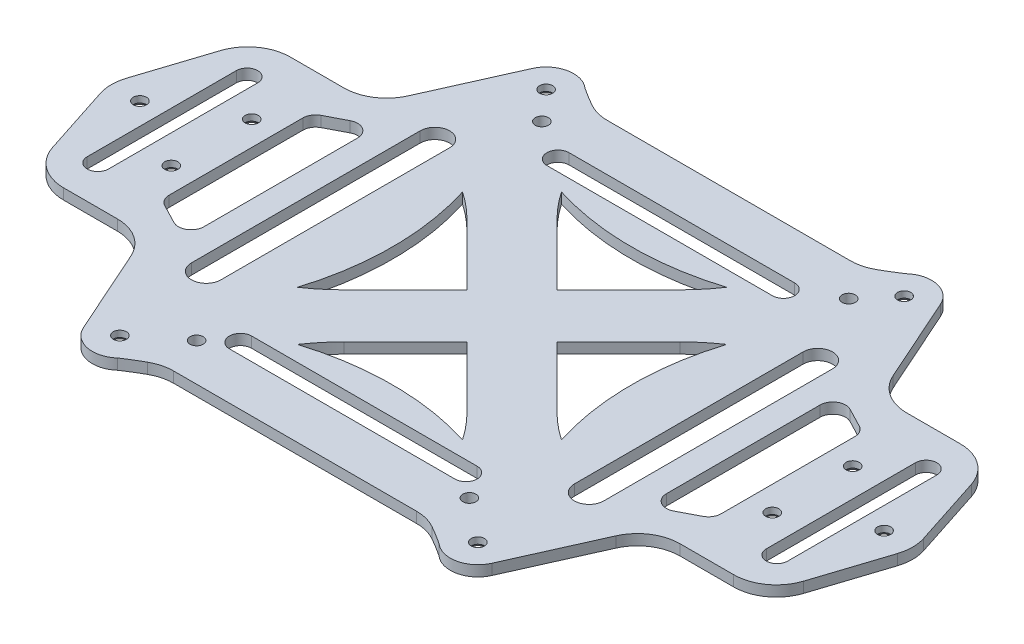
from build123d import *

# Parameters (mm, degrees)
SKETCH_1_R             = 1.55
EXTRUDE_1_DEPTH        = 2.5
FILLET_1_R             = 10
CHAMFER_2_SIZE         = 1
CUT_EXTRUDE_5190_DEPTH = 110.674480491
FILLET_2_R             = 3


with BuildPart() as part:
    # 草图1 → 凸台-拉伸1 (new body)
    with BuildSketch(Plane(origin=(0, 0, 0), x_dir=(1, 0, 0), z_dir=(0, 1, 0))):
        with BuildLine():
            Line((47.899982554, 52.633397656), (59.52497064, 26.588251477))
            Line((59.52497064, 26.588251477), (85.869588061, 26.588251477))
            Line((85.869588061, 26.588251477), (94.505759306, 0))
            Line((94.505759306, 0), (85.869588061, -26.588251477))
            Line((85.869588061, -26.588251477), (59.52497064, -26.588251477))
            Line((59.52497064, -26.588251477), (47.899982554, -52.633397656))
            ThreePointArc((47.899982554, -52.633397656), (43.362068791, -56.315801292), (37.709796983, -54.831018053))
            ThreePointArc((37.709796983, -54.831018053), (34.400449937, -52.764318952), (30.978168019, -50.89055015))
            Line((30.978168019, -50.89055015), (-30.978168019, -50.89055015))
            ThreePointArc((-30.978168019, -50.89055015), (-34.400449937, -52.764318952), (-37.709796983, -54.831018053))
            ThreePointArc((-37.709796983, -54.831018053), (-43.362068791, -56.315801292), (-47.899982554, -52.633397656))
            Line((-47.899982554, -52.633397656), (-59.52497064, -26.588251477))
            Line((-59.52497064, -26.588251477), (-85.869588061, -26.588251477))
            Line((-85.869588061, -26.588251477), (-94.505759306, 0))
            Line((-94.505759306, 0), (-85.869588061, 26.588251477))
            Line((-85.869588061, 26.588251477), (-59.52497064, 26.588251477))
            Line((-59.52497064, 26.588251477), (-47.899982554, 52.633397656))
            ThreePointArc((-47.899982554, 52.633397656), (-43.362068791, 56.315801292), (-37.709796983, 54.831018053))
            ThreePointArc((-37.709796983, 54.831018053), (-34.400449937, 52.764318952), (-30.978168019, 50.89055015))
            Line((-30.978168019, 50.89055015), (30.978168019, 50.89055015))
            ThreePointArc((30.978168019, 50.89055015), (34.400449937, 52.764318952), (37.709796983, 54.831018053))
            ThreePointArc((37.709796983, 54.831018053), (43.362068791, 56.315801292), (47.899982554, 52.633397656))
        make_face()
        with Locations((42, 50)):
            Circle(SKETCH_1_R, mode=Mode.SUBTRACT)
        with Locations((42, -50)):
            Circle(SKETCH_1_R, mode=Mode.SUBTRACT)
        with Locations((-42, -50)):
            Circle(SKETCH_1_R, mode=Mode.SUBTRACT)
        with Locations((-42, 50)):
            Circle(SKETCH_1_R, mode=Mode.SUBTRACT)
        with Locations((36, 43)):
            Circle(SKETCH_1_R, mode=Mode.SUBTRACT)
        with Locations((32, -42)):
            Circle(SKETCH_1_R, mode=Mode.SUBTRACT)
        with Locations((-32, -42)):
            Circle(SKETCH_1_R, mode=Mode.SUBTRACT)
        with Locations((-36, 43)):
            Circle(SKETCH_1_R, mode=Mode.SUBTRACT)
        with Locations((70.5, 9.435839055)):
            Circle(SKETCH_1_R, mode=Mode.SUBTRACT)
        with Locations((70.5, -9.435839055)):
            Circle(SKETCH_1_R, mode=Mode.SUBTRACT)
        with Locations((-70.5, -9.435839055)):
            Circle(SKETCH_1_R, mode=Mode.SUBTRACT)
        with Locations((-70.5, 9.435839055)):
            Circle(SKETCH_1_R, mode=Mode.SUBTRACT)
        with Locations((87.3, 0)):
            Circle(SKETCH_1_R, mode=Mode.SUBTRACT)
        with Locations((-87.3, 0)):
            Circle(SKETCH_1_R, mode=Mode.SUBTRACT)
        with BuildLine():
            Line((77.169642998, -17.5), (77.169642998, 17.5))
            ThreePointArc((77.169642998, 17.5), (79.669642998, 20), (82.169642998, 17.5))
            Line((82.169642998, 17.5), (82.169642998, -17.5))
            ThreePointArc((82.169642998, -17.5), (79.669642998, -20), (77.169642998, -17.5))
        make_face(mode=Mode.SUBTRACT)
        with BuildLine():
            Line((-77.169642998, -17.5), (-77.169642998, 17.5))
            ThreePointArc((-77.169642998, 17.5), (-79.669642998, 20), (-82.169642998, 17.5))
            Line((-82.169642998, 17.5), (-82.169642998, -17.5))
            ThreePointArc((-82.169642998, -17.5), (-79.669642998, -20), (-77.169642998, -17.5))
        make_face(mode=Mode.SUBTRACT)
        with BuildLine():
            Line((-24.995975583, 14.429581723), (-10.56639386, 0))
            Line((-10.56639386, 0), (-24.995975583, -14.429581723))
            ThreePointArc((-24.995975583, -14.429581723), (-27.869597938, -17.042325553), (-30.978168019, -19.370614155))
            ThreePointArc((-30.978168019, -19.370614155), (-28.024295248, 0), (-30.978168019, 19.370614155))
            ThreePointArc((-30.978168019, 19.370614155), (-27.869597938, 17.042325553), (-24.995975583, 14.429581723))
        make_face(mode=Mode.SUBTRACT)
        with BuildLine():
            Line((14.429581723, 24.995975583), (0, 10.56639386))
            Line((0, 10.56639386), (-14.429581723, 24.995975583))
            ThreePointArc((-14.429581723, 24.995975583), (-17.042325553, 27.869597938), (-19.370614155, 30.978168019))
            ThreePointArc((-19.370614155, 30.978168019), (0, 28.024295248), (19.370614155, 30.978168019))
            ThreePointArc((19.370614155, 30.978168019), (17.042325553, 27.869597938), (14.429581723, 24.995975583))
        make_face(mode=Mode.SUBTRACT)
        with BuildLine():
            Line((24.995975583, -14.429581723), (10.56639386, 0))
            Line((10.56639386, 0), (24.995975583, 14.429581723))
            ThreePointArc((24.995975583, 14.429581723), (27.869597938, 17.042325553), (30.978168019, 19.370614155))
            ThreePointArc((30.978168019, 19.370614155), (28.024295248, 0), (30.978168019, -19.370614155))
            ThreePointArc((30.978168019, -19.370614155), (27.869597938, -17.042325553), (24.995975583, -14.429581723))
        make_face(mode=Mode.SUBTRACT)
        with BuildLine():
            Line((-14.429581723, -24.995975583), (0, -10.56639386))
            Line((0, -10.56639386), (14.429581723, -24.995975583))
            ThreePointArc((14.429581723, -24.995975583), (17.042325553, -27.869597938), (19.370614155, -30.978168019))
            ThreePointArc((19.370614155, -30.978168019), (0, -28.024295248), (-19.370614155, -30.978168019))
            ThreePointArc((-19.370614155, -30.978168019), (-17.042325553, -27.869597938), (-14.429581723, -24.995975583))
        make_face(mode=Mode.SUBTRACT)
        with BuildLine():
            Line((41.468701347, -26.829343455), (41.468701347, 26.829343455))
            ThreePointArc((41.468701347, 26.829343455), (44.919200659, 30.279842767), (48.36969997, 26.829343455))
            Line((48.36969997, 26.829343455), (48.36969997, -26.829343455))
            ThreePointArc((48.36969997, -26.829343455), (44.919200659, -30.279842767), (41.468701347, -26.829343455))
        make_face(mode=Mode.SUBTRACT)
        with BuildLine():
            Line((-26.453510137, -34.636976429), (26.453510137, -34.636976429))
            ThreePointArc((26.453510137, -34.636976429), (29.060662927, -37.244129219), (26.453510137, -39.851282009))
            Line((26.453510137, -39.851282009), (-26.453510137, -39.851282009))
            ThreePointArc((-26.453510137, -39.851282009), (-29.060662927, -37.244129219), (-26.453510137, -34.636976429))
        make_face(mode=Mode.SUBTRACT)
        with BuildLine():
            Line((-26.453510137, 34.636976429), (26.453510137, 34.636976429))
            ThreePointArc((26.453510137, 34.636976429), (29.060662927, 37.244129219), (26.453510137, 39.851282009))
            Line((26.453510137, 39.851282009), (-26.453510137, 39.851282009))
            ThreePointArc((-26.453510137, 39.851282009), (-29.060662927, 37.244129219), (-26.453510137, 34.636976429))
        make_face(mode=Mode.SUBTRACT)
        with BuildLine():
            Line((-41.468701347, -26.829343455), (-41.468701347, 26.829343455))
            ThreePointArc((-41.468701347, 26.829343455), (-44.919200659, 30.279842767), (-48.36969997, 26.829343455))
            Line((-48.36969997, 26.829343455), (-48.36969997, -26.829343455))
            ThreePointArc((-48.36969997, -26.829343455), (-44.919200659, -30.279842767), (-41.468701347, -26.829343455))
        make_face(mode=Mode.SUBTRACT)
    extrude(amount=EXTRUDE_1_DEPTH)

    # 圆角1
    fillet_1_edges = [part.edges().sort_by_distance(p)[0] for p in [
        (59.52497064, 1.25, -26.588251477),
        (85.869588061, 1.25, -26.588251477),
        (85.869588061, 1.25, 26.588251477),
        (94.505759306, 1.25, 0),
        (59.52497064, 1.25, 26.588251477),
        (-59.52497064, 1.25, 26.588251477),
        (-59.52497064, 1.25, -26.588251477),
        (-85.869588061, 1.25, -26.588251477),
        (-85.869588061, 1.25, 26.588251477),
        (-94.505759306, 1.25, 0),
        (30.978168019, 1.25, -50.89055015),
        (-30.978168019, 1.25, -50.89055015),
        (30.978168019, 1.25, 50.89055015),
        (-30.978168019, 1.25, 50.89055015),
    ]]
    fillet(fillet_1_edges, radius=FILLET_1_R)

    # 倒角2
    chamfer_2_edges = [part.edges().sort_by_distance(p)[0] for p in [
        (-72.05, 0, 9.435839055),
        (-72.05, 0, -9.435839055),
        (68.95, 0, 9.435839055),
        (68.95, 0, -9.435839055),
        (-88.85, 0, 0),
        (85.75, 0, 0),
        (-43.55, 0, 50),
        (40.45, 0, 50),
        (-43.55, 0, -50),
        (40.45, 0, -50),
    ]]
    chamfer(chamfer_2_edges, length=CHAMFER_2_SIZE)

    # Sketch 4946 → Cut-Extrude 5190 (cut, through all)
    with BuildSketch(Plane.XZ):
        Polygon((-64.75, 17.5), (-54.25, 22.965954031), (-54.25, -22.965954031), (-64.75, -17.5), align=None)
        Polygon((54.25, -22.965954031), (64.75, -17.5), (64.75, 17.5), (54.25, 22.965954031), align=None)
    extrude(amount=-CUT_EXTRUDE_5190_DEPTH, mode=Mode.SUBTRACT)

    # 圆角2
    fillet_2_edges = [part.edges().sort_by_distance(p)[0] for p in [
        (64.75, 1.25, 17.5),
        (64.75, 1.25, -17.5),
        (54.25, 1.25, -22.965954031),
        (54.25, 1.25, 22.965954031),
        (-54.25, 1.25, -22.965954031),
        (-64.75, 1.25, -17.5),
        (-64.75, 1.25, 17.5),
        (-54.25, 1.25, 22.965954031),
    ]]
    fillet(fillet_2_edges, radius=FILLET_2_R)


solid = part.part
